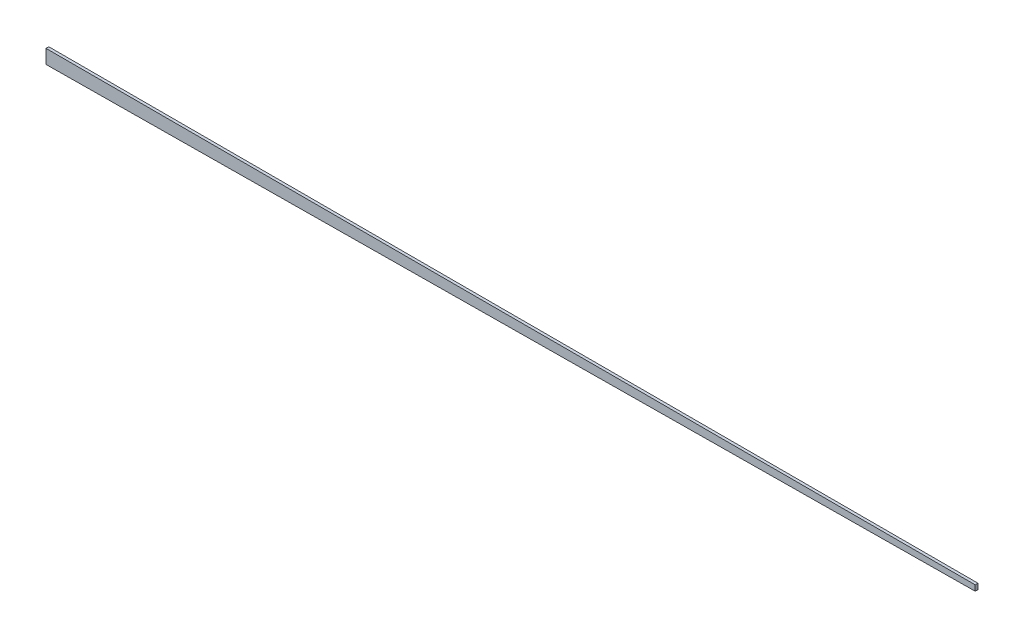
from build123d import *

# Parameters (mm, degrees)
BOSS_EXTRUDE1_DEPTH = 3


with BuildPart() as part:
    # Sketch1 → Boss-Extrude1 (new body)
    with BuildSketch(Plane.XY):
        Polygon((0, 0), (1000, 9), (1000, 15), (0, 15), align=None)
    extrude(amount=BOSS_EXTRUDE1_DEPTH)


solid = part.part
